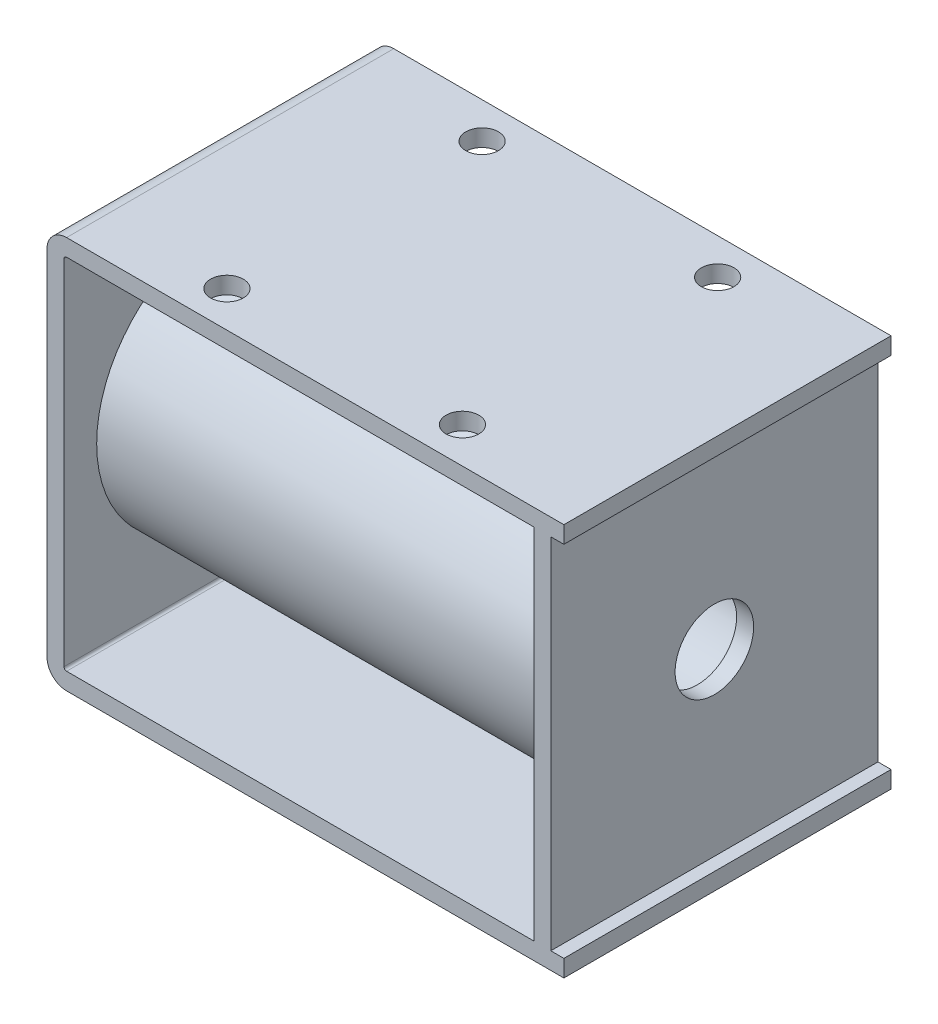
from build123d import *

# Parameters (mm, degrees)
SKETCH1_W                     = 1.3
SKETCH1_H                     = 27.4
HOUSING_DEPTH                 = 12.5
SKETCH2_R                     = 3.125
END_BOSS_DEPTH                = 0.5
SMALL_BORE_REACH              = 46.511
SKETCH3_R                     = 1.75
SKETCH4_R                     = 10
SKETCH4_R_2                   = 5
COIL_DEPTH                    = 35.9
SKETCH5_R                     = 3
LARGE_BORE_DEPTH              = 1.3
M3X0_5_START                  = 13.7
M3X0_5_TAPPED_HOLE1_OUTLINE_R = 1.25
M3X0_5_TAPPED_HOLE1_DEPTH     = 1.3
SKETCH11_R                    = 0.8


# Read off the part's stored shape, not the designer's step: M3x0.5 Tapped Hole1
with BuildPart() as part:
    # Sketch1 → Housing (new, symmetric)
    with BuildSketch(Plane.XY):
        with BuildLine():
            Line((-38.2, -13.5), (-38.2, 13.5))
            ThreePointArc((-38.2, 13.5), (-38.141421356, 13.641421356), (-38, 13.7))
            Line((-38, 13.7), (0, 13.7))
            Line((0, 13.7), (0, 15))
            Line((0, 15), (-38, 15))
            ThreePointArc((-38, 15), (-39.060660172, 14.560660172), (-39.5, 13.5))
            Line((-39.5, 13.5), (-39.5, -13.5))
            ThreePointArc((-39.5, -13.5), (-39.060660172, -14.560660172), (-38, -15))
            Line((-38, -15), (0, -15))
            Line((0, -15), (0, -13.7))
            Line((0, -13.7), (-38, -13.7))
            ThreePointArc((-38, -13.7), (-38.141421356, -13.641421356), (-38.2, -13.5))
        make_face()
        with Locations((-1.65, 0)):
            Rectangle(SKETCH1_W, SKETCH1_H)
    extrude(amount=HOUSING_DEPTH, both=True)

    # Sketch2 → End Boss (add)
    with BuildSketch(Plane.ZY.offset(39.5)):
        Circle(SKETCH2_R)
    extrude(amount=END_BOSS_DEPTH)

    # Sketch3 → Small Bore (cut, up to next)
    with BuildSketch(Plane.ZY.offset(40), mode=Mode.PRIVATE) as small_bore_sk1:
        Circle(SKETCH3_R)
    small_bore_tool1 = extrude(small_bore_sk1.sketch, amount=-SMALL_BORE_REACH, mode=Mode.PRIVATE) & part.part
    add(small_bore_tool1.solids().sort_by_distance((-40, 0, 0))[0], mode=Mode.SUBTRACT)

    # Sketch5 → Large Bore (cut)
    with BuildSketch(Plane(origin=(-1, 0, 0), x_dir=(0, 0, -1), z_dir=(1, 0, 0))):
        Circle(SKETCH5_R)
    extrude(amount=-LARGE_BORE_DEPTH, mode=Mode.SUBTRACT)

    # M3x0.5 Tapped Hole1 outline → M3x0.5 Tapped Hole1 (cut)
    with BuildSketch(Plane(origin=(0, 0, 0), x_dir=(1, 0, 0), z_dir=(0, 1, 0)).offset(M3X0_5_START)):
        with Locations((-28.5, 9.75)):
            Circle(M3X0_5_TAPPED_HOLE1_OUTLINE_R)
        with Locations((-10.5, 9.75)):
            Circle(M3X0_5_TAPPED_HOLE1_OUTLINE_R)
    m3x0_5_tapped_hole1 = extrude(amount=M3X0_5_TAPPED_HOLE1_DEPTH, mode=Mode.SUBTRACT)

    # Mirror1: M3x0.5 Tapped Hole1 across plane
    add(m3x0_5_tapped_hole1.mirror(Plane.XY), mode=Mode.SUBTRACT)


with BuildPart() as body_2:
    # Sketch4 → Coil (new body)
    with BuildSketch(Plane.ZY.offset(2.3)):
        Circle(SKETCH4_R)
        Circle(SKETCH4_R_2, mode=Mode.SUBTRACT)
    extrude(amount=COIL_DEPTH)

    # Wires 2: sweep along a path in Sketch12
    with BuildLine(Plane(origin=(0, 0, 0), x_dir=(1, 0, 0), z_dir=(0, 1, 0))) as wires_2_path:
        Line((-39.5, 9.774082389), (-28.981684691, 9.774082389))
        ThreePointArc((-28.981684691, 9.774082389), (-27.383714597, 9.404319945), (-26.110595638, 8.370201575))
        Line((-26.110595638, 8.370201575), (-24.934313388, 6.858404062))
    # Sketch11 → Wires 2 (sweep)
    with BuildSketch(Plane(origin=(-39.5, 0, 0), x_dir=(0, 0, -1), z_dir=(1, 0, 0))):
        with Locations((9.774082389, 0.81)):
            Circle(SKETCH11_R)
        with Locations((9.774082389, -0.81)):
            Circle(SKETCH11_R)
    sweep(path=wires_2_path.line)


solid = Compound([part.part, body_2.part])
